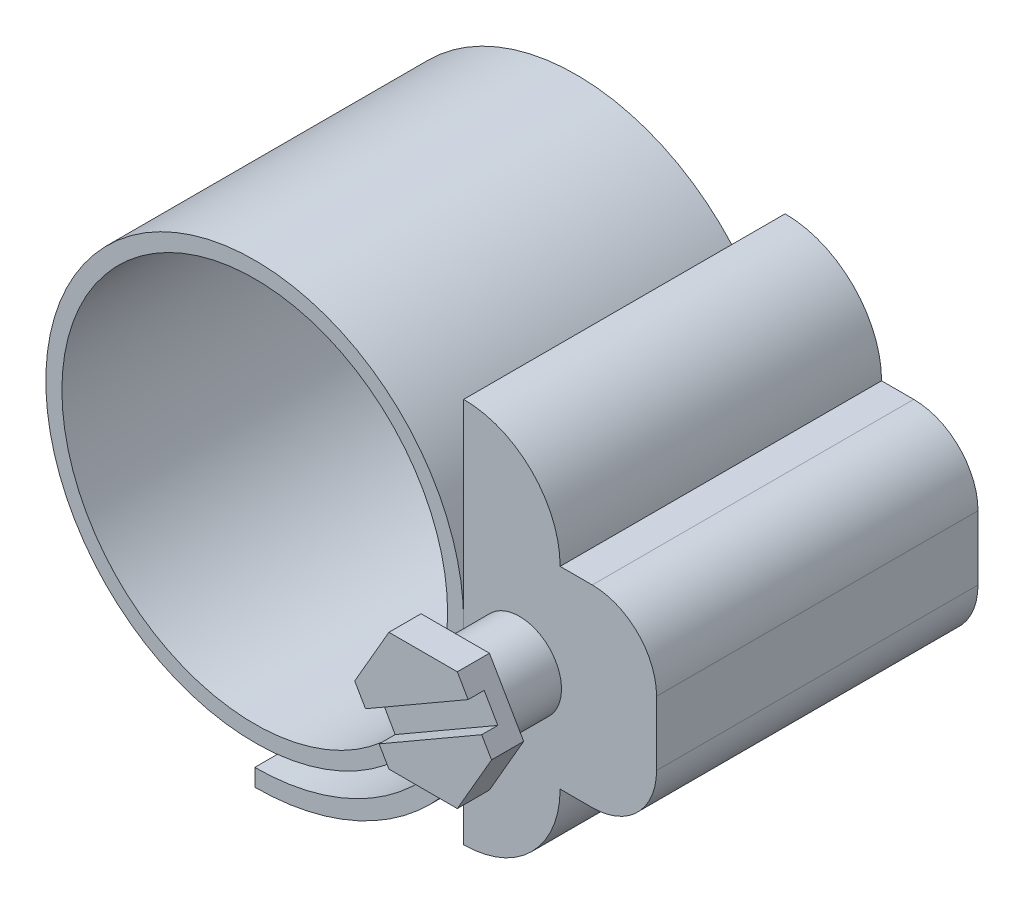
from build123d import *

# Parameters (mm, degrees)
ESBO_O1_R                = 6.5
ESBO_O1_R_2              = 6
RESSALTO_EXTRUS_O1_DEPTH = 10
RESSALTO_EXTRUS_O2_DEPTH = 10
RESSALTO_EXTRUS_O3_DEPTH = 3
FILETE1_R                = 2
FILETE2_R                = 3
ESBO_O4_R                = 1.304081641
RESSALTO_EXTRUS_O4_DEPTH = 2
RESSALTO_EXTRUS_O5_DEPTH = 1
CORTE_EXTRUS_O1_DEPTH    = 0.5
RESSALTO_EXTRUS_O6_DEPTH = 10


with BuildPart() as part:
    # Esboço1 → Ressalto-extrusão1 (new body)
    with BuildSketch(Plane.XY):
        Circle(ESBO_O1_R)
        Circle(ESBO_O1_R_2, mode=Mode.SUBTRACT)
    extrude(amount=RESSALTO_EXTRUS_O1_DEPTH)


with BuildPart() as body_2:
    # Esboço2 → Ressalto-extrusão2 (new body)
    with BuildSketch(Plane.XY.offset(10)):
        Polygon((6.5, 0), (6.5, 6), (9.5, 6), (9.5, -6), (6.5, -6), align=None)
    extrude(amount=-RESSALTO_EXTRUS_O2_DEPTH)

    # Esboço3 → Ressalto-extrusão3 (add)
    with BuildSketch(Plane(origin=(9.5, 0, 0), x_dir=(0, 0, -1), z_dir=(1, 0, 0))):
        Polygon((0, 0), (0, 3), (-10, 3), (-10, -3), (0, -3), align=None)
    extrude(amount=RESSALTO_EXTRUS_O3_DEPTH)

    # Filete1
    filete1_edges = [body_2.edges().sort_by_distance(p)[0] for p in [
        (12.5, -3, 5),
        (12.5, 3, 5),
    ]]
    fillet(filete1_edges, radius=FILETE1_R)

    # Filete2
    filete2_edges = [body_2.edges().sort_by_distance(p)[0] for p in [
        (9.5, -6, 5),
        (9.5, 6, 5),
    ]]
    fillet(filete2_edges, radius=FILETE2_R - 0.0001)  # a hair under: the kernel refuses the full size

    # Esboço4 → Ressalto-extrusão4 (add)
    with BuildSketch(Plane.XY.offset(10)):
        with Locations(Location((8.237547689, -0.281806099, 0), (0, 0, 180))):
            Circle(ESBO_O4_R)
    extrude(amount=RESSALTO_EXTRUS_O4_DEPTH)

    # Esboço5 → Ressalto-extrusão5 (add)
    with BuildSketch(Plane.XY.offset(12)):
        Polygon((10.365558356, -0.281806099), (9.301553023, 1.561105198), (7.173542356, 1.561105198), (6.109537022, -0.281806099), (7.173542356, -2.124717396), (9.301553023, -2.124717396), align=None)
    extrude(amount=RESSALTO_EXTRUS_O5_DEPTH)

    # Esboço6 → Corte-extrusão1 (cut)
    with BuildSketch(Plane.XY.offset(13)):
        Polygon((10.061017875, 0.245673487), (9.833555689, 0.63964955), (9.637214047, 0.979723249), (6.445198047, -0.863188048), (6.869001875, -1.59723781), align=None)
    extrude(amount=-CORTE_EXTRUS_O1_DEPTH, mode=Mode.SUBTRACT)

    # Esboço7 → Ressalto-extrusão6 (add)
    with BuildSketch(Plane.XY.offset(10)):
        with BuildLine():
            ThreePointArc((0, -7.699972578), (3.708425738, -6.748122424), (6.5, -4.127902337))
            Line((6.5, -4.127902337), (6.5, -3.013766987))
            ThreePointArc((6.5, -3.013766987), (3.856169306, -6.038439346), (0, -7.164690604))
            Line((0, -7.164690604), (0, -7.699972578))
        make_face()
    extrude(amount=-RESSALTO_EXTRUS_O6_DEPTH)


solid = Compound([part.part, body_2.part])
